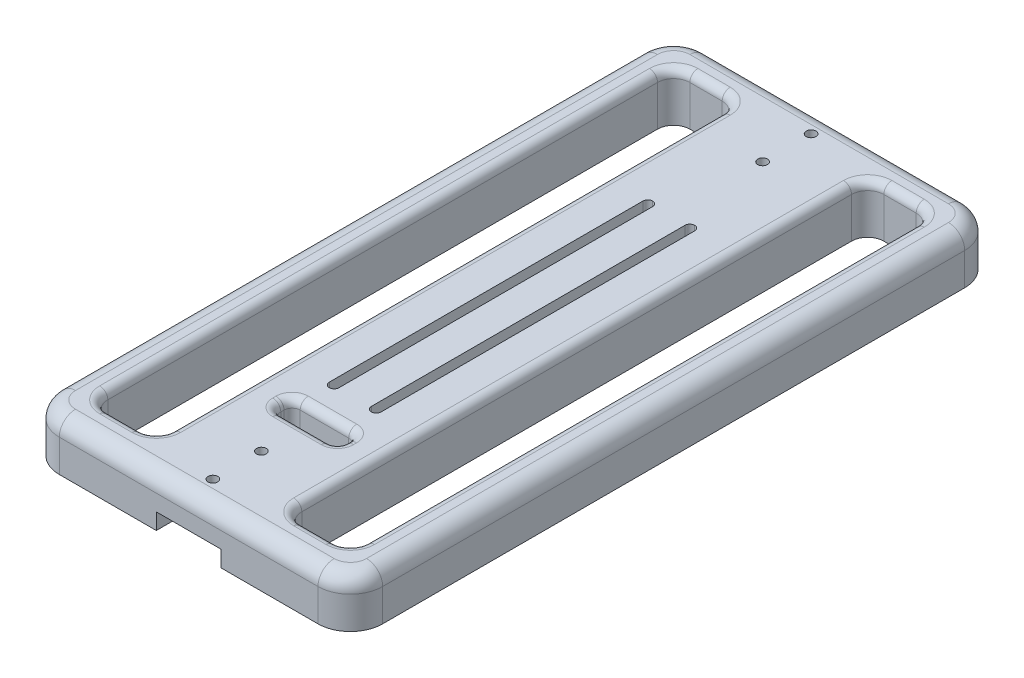
from build123d import *

# Parameters (mm, degrees)
SKETCH1_W             = 100
SKETCH1_H             = 200
BOSS_EXTRUDE1_DEPTH   = 15
SKETCH4_W             = 20
SKETCH4_H             = 30
SKETCH4_W_2           = 7
SKETCH4_H_2           = 104
CUT_EXTRUDE2_DEPTH    = 5
FILLET3_R             = 10
FILLET4_R             = 5
SKETCH8_W             = 20
SKETCH8_H             = 180
SKETCH8_W_2           = 3
SKETCH8_H_2           = 100
SKETCH8_H_3           = 6
CUT_EXTRUDE3_DEPTH    = 15
FILLET5_R             = 5
FILLET8_R             = 2.5
FILLET7_R             = 2.5
FILLET10_R            = 1.5
F_3_0MM_DOWEL_HOLE1_D = 3
F_3_0MM_DOWEL_HOLE2_D = 3


with BuildPart() as part:
    # Sketch1 → Boss-Extrude1 (new body)
    with BuildSketch(Plane(origin=(0, 0, 0), x_dir=(1, 0, 0), z_dir=(0, 1, 0))):
        Rectangle(SKETCH1_W, SKETCH1_H)
    extrude(amount=BOSS_EXTRUDE1_DEPTH)

    # Sketch4 → Cut-Extrude2 (cut)
    with BuildSketch(Plane.XZ):
        with Locations((0, 85)):
            Rectangle(SKETCH4_W, SKETCH4_H)
        with Locations((0, -85)):
            Rectangle(SKETCH4_W, SKETCH4_H)
        with Locations((-6.5, 0)):
            Rectangle(SKETCH4_W_2, SKETCH4_H_2)
        with Locations((6.5, 0)):
            Rectangle(SKETCH4_W_2, SKETCH4_H_2)
    extrude(amount=-CUT_EXTRUDE2_DEPTH, mode=Mode.SUBTRACT)

    # Fillet3
    fillet3_edges = [part.edges().sort_by_distance(p)[0] for p in [
        (50, 7.5, 100),
        (-50, 7.5, 100),
        (-50, 7.5, -100),
        (50, 7.5, -100),
    ]]
    fillet(fillet3_edges, radius=FILLET3_R)

    # Fillet4
    fillet4_edges = [part.edges().sort_by_distance(p)[0] for p in [
        (0, 15, -100),
        (50, 15, 0),
        (-50, 15, 0),
        (0, 15, 100),
        (47.071067812, 15, 97.071067812),
        (-47.071067812, 15, 97.071067812),
        (-47.071067812, 15, -97.071067812),
        (47.071067812, 15, -97.071067812),
    ]]
    fillet(fillet4_edges, radius=FILLET4_R)

    # Sketch8 → Cut-Extrude3 (cut)
    with BuildSketch(Plane.XZ):
        with Locations((30, 0)):
            Rectangle(SKETCH8_W, SKETCH8_H)
        with Locations((-30, 0)):
            Rectangle(SKETCH8_W, SKETCH8_H)
        with Locations((-6.5, 0)):
            Rectangle(SKETCH8_W_2, SKETCH8_H_2)
        with Locations((6.5, 0)):
            Rectangle(SKETCH8_W_2, SKETCH8_H_2)
        with Locations((0, 61)):
            Rectangle(SKETCH8_W, SKETCH8_H_3)
    extrude(amount=-CUT_EXTRUDE3_DEPTH, mode=Mode.SUBTRACT)

    # Fillet5
    fillet5_edges = [part.edges().sort_by_distance(p)[0] for p in [
        (20, 7.5, -90),
        (20, 7.5, 90),
        (40, 7.5, 90),
        (40, 7.5, -90),
        (-40, 7.5, -90),
        (-40, 7.5, 90),
        (-20, 7.5, 90),
        (-20, 7.5, -90),
    ]]
    fillet(fillet5_edges, radius=FILLET5_R)

    # Fillet8
    fillet8_edges = [part.edges().sort_by_distance(p)[0] for p in [
        (-10, 7.5, 58),
        (-10, 7.5, 64),
        (10, 7.5, 64),
        (10, 7.5, 58),
    ]]
    fillet(fillet8_edges, radius=FILLET8_R)

    # Fillet7
    fillet7_edges = [part.edges().sort_by_distance(p)[0] for p in [
        (-30, 15, -90),
        (-40, 15, 0),
        (-20, 15, 0),
        (30, 15, -90),
        (20, 15, 0),
        (40, 15, 0),
        (-30, 15, 90),
        (30, 15, 90),
        (-38.535533906, 15, -88.535533906),
        (-21.464466094, 15, -88.535533906),
        (21.464466094, 15, -88.535533906),
        (38.535533906, 15, -88.535533906),
        (-21.464466094, 15, 88.535533906),
        (-38.535533906, 15, 88.535533906),
        (21.464466094, 15, 88.535533906),
        (38.535533906, 15, 88.535533906),
        (0, 15, 64),
        (10, 15, 61),
        (0, 15, 58),
        (-10, 15, 61),
        (9.267766953, 15, 63.267766953),
        (9.267766953, 15, 58.732233047),
        (-9.267766953, 15, 58.732233047),
        (-9.267766953, 15, 63.267766953),
    ]]
    fillet(fillet7_edges, radius=FILLET7_R)

    # Fillet10
    fillet10_edges = [part.edges().sort_by_distance(p)[0] for p in [
        (8, 10, -50),
        (5, 10, -50),
        (-5, 10, -50),
        (-8, 10, -50),
        (5, 10, 50),
        (8, 10, 50),
        (-8, 10, 50),
        (-5, 10, 50),
    ]]
    fillet(fillet10_edges, radius=FILLET10_R - 0.0001)  # a hair under: the kernel refuses the full size

    # Ø3.0mm Dowel Hole1 (through all)
    with Locations(Plane(origin=(0, 5, 0), x_dir=(-1, 0, 0), z_dir=(0, -1, 0))):
        with Locations((0, 77.5), (0, 92.5)):
            Hole(F_3_0MM_DOWEL_HOLE1_D / 2)

    # Ø3.0mm Dowel Hole2 (through all)
    with Locations(Plane(origin=(0, 5, 0), x_dir=(-1, 0, 0), z_dir=(0, -1, 0))):
        with Locations((0, -92.5), (0, -77.5)):
            Hole(F_3_0MM_DOWEL_HOLE2_D / 2)


solid = part.part
